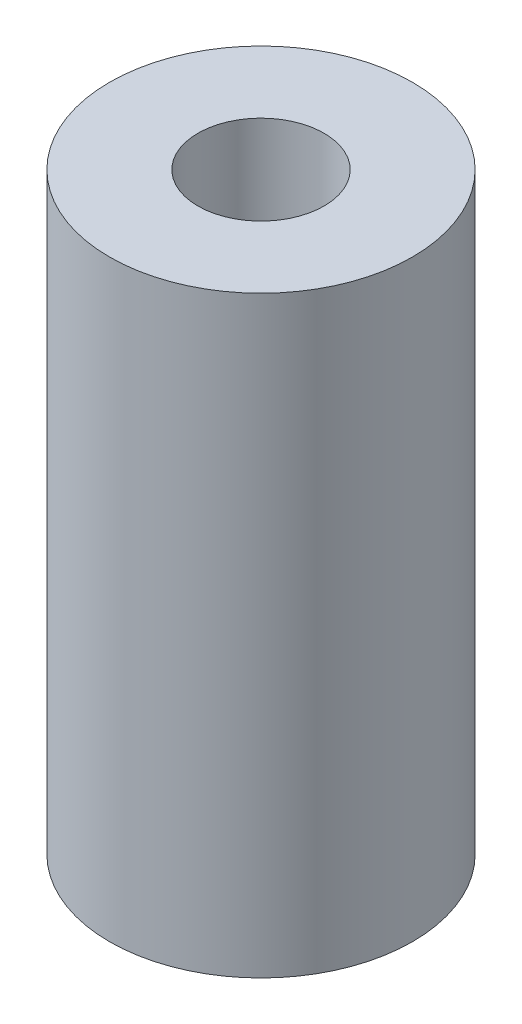
from build123d import *

# Parameters (mm, degrees)
SKETCH1_R           = 12
BOSS_EXTRUDE1_DEPTH = 47
SKETCH2_R           = 5
CUT_EXTRUDE1_DEPTH  = 50.969990995


with BuildPart() as part:
    # Sketch1 → Boss-Extrude1 (new body)
    with BuildSketch(Plane(origin=(0, 0, 0), x_dir=(1, 0, 0), z_dir=(0, 1, 0))):
        Circle(SKETCH1_R)
    extrude(amount=BOSS_EXTRUDE1_DEPTH)

    # Sketch2 → Cut-Extrude1 (cut, through all)
    with BuildSketch(Plane(origin=(0, 47, 0), x_dir=(1, 0, 0), z_dir=(0, 1, 0))):
        Circle(SKETCH2_R)
    extrude(amount=-CUT_EXTRUDE1_DEPTH, mode=Mode.SUBTRACT)


solid = part.part
